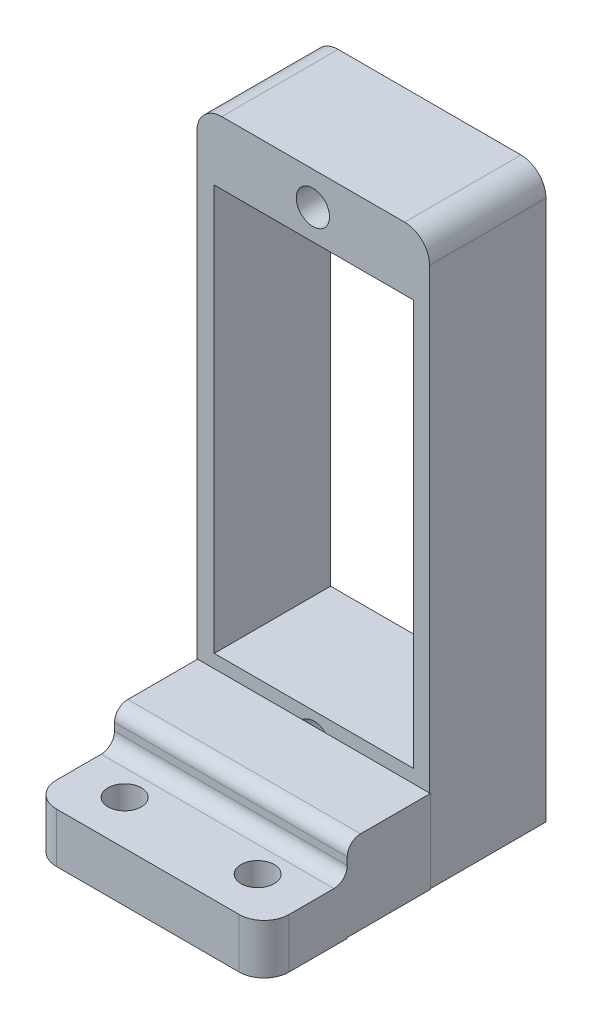
from build123d import *

# Parameters (mm, degrees)
SKETCH1_W           = 14
SKETCH1_H           = 34
BOSS_EXTRUDE1_DEPTH = 7
SKETCH2_R           = 1
SKETCH2_W           = 12
SKETCH2_H           = 24.4
CUT_EXTRUDE1_DEPTH  = 555.564285541
SKETCH3_W           = 14
SKETCH3_H           = 5
BOSS_EXTRUDE2_DEPTH = 5
SKETCH4_W           = 14
SKETCH4_H           = 3
BOSS_EXTRUDE3_DEPTH = 5
FILLET1_R           = 1.5
FILLET2_R           = 0.8
SKETCH5_R           = 1
CUT_EXTRUDE2_DEPTH  = 7
SKETCH6_R           = 1
CUT_EXTRUDE3_DEPTH  = 252.483055086


with BuildPart() as part:
    # Sketch1 → Boss-Extrude1 (new body)
    with BuildSketch(Plane.XY.offset(25)):
        with Locations((238.952994655, 479.990614818)):
            Rectangle(SKETCH1_W, SKETCH1_H)
    extrude(amount=BOSS_EXTRUDE1_DEPTH)

    # Sketch2 → Cut-Extrude1 (cut, through all)
    with BuildSketch(Plane.XY.offset(32)):
        with Locations((238.935079192, 495.003072258)):
            Circle(SKETCH2_R)
        with Locations((239, 481.000012207)):
            Rectangle(SKETCH2_W, SKETCH2_H)
    extrude(amount=-CUT_EXTRUDE1_DEPTH, mode=Mode.SUBTRACT)

    # Sketch3 → Boss-Extrude2 (add)
    with BuildSketch(Plane.XY.offset(32)):
        with Locations((239, 465.5)):
            Rectangle(SKETCH3_W, SKETCH3_H)
    extrude(amount=BOSS_EXTRUDE2_DEPTH)

    # Sketch4 → Boss-Extrude3 (add)
    with BuildSketch(Plane.XY.offset(37)):
        with Locations((239, 464.446662177)):
            Rectangle(SKETCH4_W, SKETCH4_H)
    extrude(amount=BOSS_EXTRUDE3_DEPTH)

    # Fillet1
    fillet1_edges = [part.edges().sort_by_distance(p)[0] for p in [
        (232, 464.446662177, 42),
        (246, 464.446662177, 42),
        (231.952994655, 496.990614818, 28.5),
        (245.952994655, 496.990614818, 28.5),
    ]]
    fillet(fillet1_edges, radius=FILLET1_R)

    # Fillet2
    fillet2_edges = [part.edges().sort_by_distance(p)[0] for p in [
        (239, 465.946662177, 37),
        (239, 468, 37),
    ]]
    fillet(fillet2_edges, radius=FILLET2_R)

    # Sketch5 → Cut-Extrude2 (cut)
    with BuildSketch(Plane(origin=(0, 0, 25), x_dir=(-1, 0, 0), z_dir=(0, 0, -1))):
        with Locations((-238.99635452, 467.272454622)):
            Circle(SKETCH5_R)
    extrude(amount=-CUT_EXTRUDE2_DEPTH, mode=Mode.SUBTRACT)

    # Sketch6 → Cut-Extrude3 (cut, through all)
    with BuildSketch(Plane(origin=(0, 465.946662177, 0), x_dir=(1, 0, 0), z_dir=(0, 1, 0))):
        with Locations((234.951502539, -39.341225233)):
            Circle(SKETCH6_R)
        with Locations((242.951502539, -39.341225233)):
            Circle(SKETCH6_R)
    extrude(amount=-CUT_EXTRUDE3_DEPTH, mode=Mode.SUBTRACT)


solid = part.part
